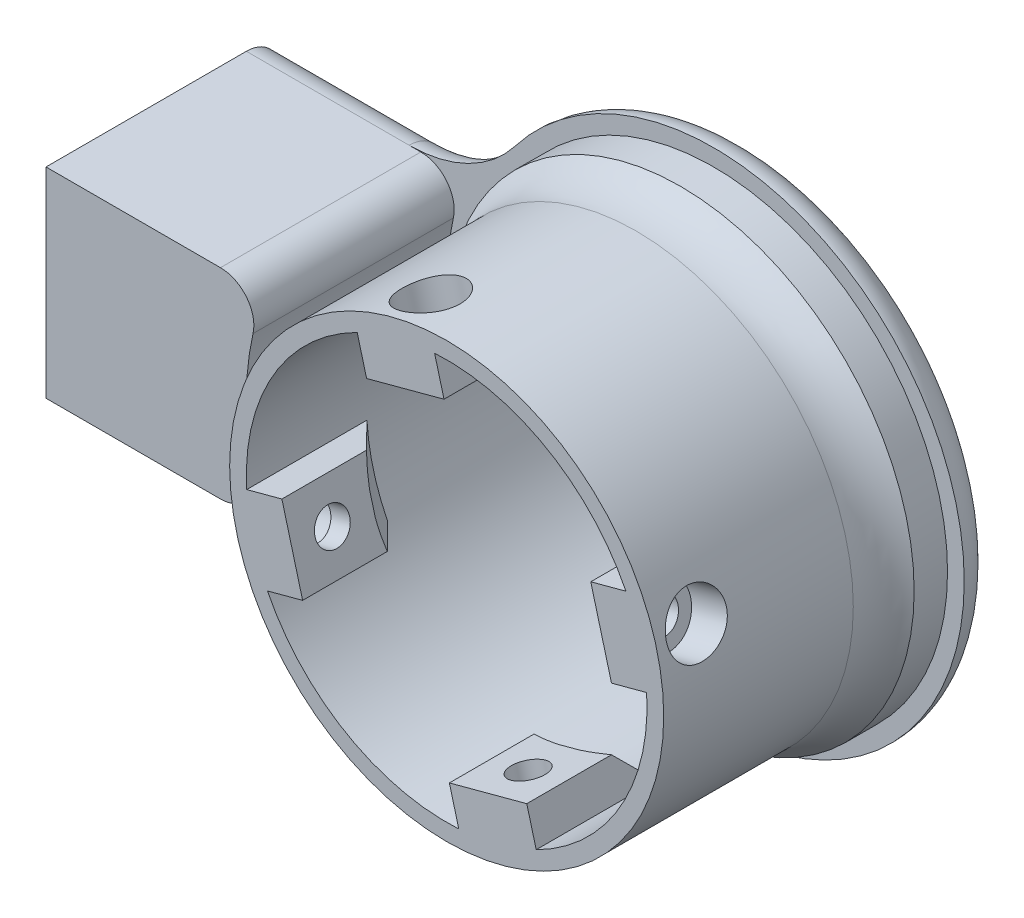
from build123d import *

# Parameters (mm, degrees)
ESQUISSE1_R                               = 30
BOSS_EXTRU_1_DEPTH                        = 5
ESQUISSE6_R                               = 35
ESQUISSE6_R_2                             = 30
BOSS_EXTRU_6_DEPTH                        = 5
ESQUISSE7_R                               = 32.5
ESQUISSE7_R_2                             = 30
BOSS_EXTRU_8_DEPTH                        = 35
CONG_2_R                                  = 10
BOSS_EXTRU_9_DEPTH                        = 30
BOSS_EXTRU_10_DEPTH                       = 12
CHANFREIN1_SIZE                           = 6
CONG_3_R                                  = 5
ENL_V_MAT_EXTRU_1_REACH                   = 89.234
ENL_V_MAT_EXTRU_1_END_RADIUS              = 32.5
ESQUISSE10_R                              = 4.5
ESQUISSE11_R                              = 4.5
ESQUISSE11_R_2                            = 2.6
BOSS_EXTRU_11_DEPTH                       = 3
R_P_TITION_CIRCULAIRE1_COUNT              = 4
CHANFREIN1_OF_R_P_TITION_CIRCULAIRE1_SIZE = 6


# Some blends are built 0.0001 mm under size
with BuildPart() as part:
    # Esquisse1 → Boss.-Extru.1 (new body)
    with BuildSketch(Plane.XY):
        with BuildLine():
            Line((-45.620718977, 15), (-70, 15))
            Line((-70, 15), (-70, -15))
            Line((-70, -15), (-45.620718977, -15))
            ThreePointArc((-45.620718977, -15), (-36.774201608, -17.062911874), (-29.752642811, -22.826086957))
            ThreePointArc((-29.752642811, -22.826086957), (37.5, 0), (-29.752642811, 22.826086957))
            ThreePointArc((-29.752642811, 22.826086957), (-36.774201608, 17.062911874), (-45.620718977, 15))
        make_face()
        Circle(ESQUISSE1_R, mode=Mode.SUBTRACT)
    extrude(amount=BOSS_EXTRU_1_DEPTH)

    # Esquisse6 → Boss.-Extru.6 (add)
    with BuildSketch(Plane.XY.offset(5)):
        Circle(ESQUISSE6_R)
        Circle(ESQUISSE6_R_2, mode=Mode.SUBTRACT)
    extrude(amount=BOSS_EXTRU_6_DEPTH)

    # Esquisse7 → Boss.-Extru.8 (add)
    with BuildSketch(Plane.XY.offset(10)):
        Circle(ESQUISSE7_R)
        Circle(ESQUISSE7_R_2, mode=Mode.SUBTRACT)
    extrude(amount=BOSS_EXTRU_8_DEPTH)

    # Congé2
    # the kernel refuses this fillet: 10 mm, written as the material it adds along each edge
    with BuildSketch(Plane(origin=(0, 0, 10), x_dir=(1, 0, 0), z_dir=(0, -1, 0))) as cong_2_piece_1:
        with BuildLine():
            CenterArc((42.5, 6.614378278), CONG_2_R, 180, 41.409622109)
            Line((32.5, 6.614378278), (32.3, 6.614378278))
            Line((32.3, 6.614378278), (32.3, 0))
            Line((32.3, 0), (32.5, -0.2))
            ThreePointArc((32.5, -0.2), (33.75, -0.2), (34.85, -0.132287566))
            Line((34.85, -0.132287566), (35, 0))
        make_face()
    revolve(axis=Axis((0, 0, 10), (0, 0, 1)))

    # Esquisse8 → Boss.-Extru.9 (add)
    with BuildSketch(Plane.XY.offset(5)):
        with BuildLine():
            Line((-70, -15), (-70, 15))
            Line((-70, 15), (-43.874821937, 15))
            ThreePointArc((-43.874821937, 15), (-39.966142137, 13.118047822), (-38.999841722, 8.888888889))
            ThreePointArc((-38.999841722, 8.888888889), (-40, 0), (-38.999841722, -8.888888889))
            ThreePointArc((-38.999841722, -8.888888889), (-39.966142137, -13.118047822), (-43.874821937, -15))
            Line((-43.874821937, -15), (-70, -15))
        make_face()
    extrude(amount=BOSS_EXTRU_9_DEPTH)

    # Esquisse9 → Boss.-Extru.10 (add)
    with BuildSketch(Plane.XY.offset(45)):
        Polygon((-32.405891584, -2.471475398), (-29.300063043, -14.062585313), (-21.572656433, -11.992032952), (-24.678484974, -0.400923037), align=None)
    boss_extru_10 = extrude(amount=-BOSS_EXTRU_10_DEPTH)

    # Chanfrein1
    # the kernel refuses this chamfer: 6 mm, written as the material it adds along each edge
    with BuildSketch(Plane(origin=(0, 0, 33), x_dir=(-0.5590908430517356, -0.8291064040373223, 0), z_dir=(0.8291064040373223, -0.5590908430517356, 0))) as chanfrein1_piece_1_section:
        Polygon((30, CHANFREIN1_SIZE), (30 - CHANFREIN1_SIZE, 0), (30, 0), align=None)
    chanfrein1_piece_1 = revolve(axis=Axis((0, 0, 33), (0, 0, -1)), revolution_arc=82.01410645, mode=Mode.PRIVATE)
    chanfrein1_piece_1 = split(chanfrein1_piece_1, bisect_by=Plane(origin=(-25.327272202, -12.998079215, 31.008979001), z_dir=(-0.25881904510251486, 0.96592582628907, 0)), keep=Keep.TOP, mode=Mode.PRIVATE)
    chanfrein1_piece_1 = split(chanfrein1_piece_1, bisect_by=Plane(origin=(-28.433100743, -1.4069693, 31.008979001), z_dir=(0.2588190451025147, -0.96592582628907, 0)), keep=Keep.TOP, mode=Mode.PRIVATE)
    chanfrein1_piece_1 = split(chanfrein1_piece_1, bisect_by=Plane(origin=(-23.125570703, -6.196477994, 31.008979001), z_dir=(-0.9659258262890699, -0.2588190451025148, 0)), keep=Keep.TOP, mode=Mode.PRIVATE)
    add(chanfrein1_piece_1)

    # Congé3
    cong_3_edges = [part.edges().sort_by_distance(p)[0] for p in [
        (37.5, 0, 0),
        (-57.810359489, 15, 0),
        (-57.810359489, -15, 0),
        (-36.774201608, -17.062911874, 0),
        (-36.774201608, 17.062911874, 0),
    ]]
    fillet(cong_3_edges, radius=CONG_3_R - 0.0001)  # a hair under: the kernel refuses the full size

    # Enlèv. mat.-Extru.1: up to this cylinder (the profile starts inside it)
    enl_v_mat_extru_1_end = Plane(origin=(0, 0, 39), z_dir=(0, 0, -1)) * Cylinder(ENL_V_MAT_EXTRU_1_END_RADIUS, 244.468, mode=Mode.PRIVATE)
    # Esquisse10 → Enlèv. mat.-Extru.1 (cut, up to the surface)
    with BuildSketch(Plane(origin=(-23.125570703, -6.196477994, 0), x_dir=(0, 0, -1), z_dir=(0.96592582628907, 0.25881904510251497, 0)), mode=Mode.PRIVATE) as enl_v_mat_extru_1_sk1:
        with Locations(Location((-39, 0, 0), (0, 0, 90))):
            Circle(ESQUISSE10_R)
    enl_v_mat_extru_1_tool1 = extrude(enl_v_mat_extru_1_sk1.sketch, amount=-ENL_V_MAT_EXTRU_1_REACH, mode=Mode.PRIVATE) & enl_v_mat_extru_1_end
    enl_v_mat_extru_1 = enl_v_mat_extru_1_tool1.solids().sort_by_distance((-23.125571, -6.196478, 39))[0]
    add(enl_v_mat_extru_1, mode=Mode.SUBTRACT)

    # Esquisse11 → Boss.-Extru.11 (add)
    with BuildSketch(Plane(origin=(-23.125570703, -6.196477994, 0), x_dir=(0, 0, -1), z_dir=(0.96592582628907, 0.25881904510251497, 0))):
        with Locations(Location((-39, 0, 0), (0, 0, 90))):
            Circle(ESQUISSE11_R)
        with Locations(Location((-39, 0, 0), (0, 0, 90))):
            Circle(ESQUISSE11_R_2, mode=Mode.SUBTRACT)
    boss_extru_11 = extrude(amount=-BOSS_EXTRU_11_DEPTH)

    # Répétition circulaire1: Boss.-Extru.10, Enlèv. mat.-Extru.1, Boss.-Extru.11 ×4 about axis
    r_p_tition_circulaire1_axis = Axis((0, 0, 0), (0, 0, 1))
    add([boss_extru_10.rotate(r_p_tition_circulaire1_axis, i * 360 / R_P_TITION_CIRCULAIRE1_COUNT) for i in range(1, R_P_TITION_CIRCULAIRE1_COUNT)])
    add([enl_v_mat_extru_1.rotate(r_p_tition_circulaire1_axis, i * 360 / R_P_TITION_CIRCULAIRE1_COUNT) for i in range(1, R_P_TITION_CIRCULAIRE1_COUNT)], mode=Mode.SUBTRACT)
    add([boss_extru_11.rotate(r_p_tition_circulaire1_axis, i * 360 / R_P_TITION_CIRCULAIRE1_COUNT) for i in range(1, R_P_TITION_CIRCULAIRE1_COUNT)])

    # Chanfrein1 of Répétition circulaire1
    # the kernel refuses this chamfer: 6 mm, written as the material it adds along each edge
    with BuildSketch(Plane(origin=(0, 0, 33), x_dir=(0.8291064040373222, -0.559090843051736, 0), z_dir=(0.559090843051736, 0.8291064040373222, 0))) as chanfrein1_of_r_p_tition_circulaire1_piece_1_section:
        Polygon((30, CHANFREIN1_OF_R_P_TITION_CIRCULAIRE1_SIZE), (30 - CHANFREIN1_OF_R_P_TITION_CIRCULAIRE1_SIZE, 0), (30, 0), align=None)
    chanfrein1_of_r_p_tition_circulaire1_piece_1 = revolve(axis=Axis((0, 0, 33), (0, 0, -1)), revolution_arc=82.01410645, mode=Mode.PRIVATE)
    chanfrein1_of_r_p_tition_circulaire1_piece_1 = split(chanfrein1_of_r_p_tition_circulaire1_piece_1, bisect_by=Plane(origin=(12.998079215, -25.327272202, 31.008979001), z_dir=(-0.96592582628907, -0.25881904510251474, 0)), keep=Keep.TOP, mode=Mode.PRIVATE)
    chanfrein1_of_r_p_tition_circulaire1_piece_1 = split(chanfrein1_of_r_p_tition_circulaire1_piece_1, bisect_by=Plane(origin=(1.4069693, -28.433100743, 31.008979001), z_dir=(0.96592582628907, 0.2588190451025146, 0)), keep=Keep.TOP, mode=Mode.PRIVATE)
    chanfrein1_of_r_p_tition_circulaire1_piece_1 = split(chanfrein1_of_r_p_tition_circulaire1_piece_1, bisect_by=Plane(origin=(6.196477994, -23.125570703, 31.008979001), z_dir=(0.25881904510251474, -0.9659258262890701, 0)), keep=Keep.TOP, mode=Mode.PRIVATE)
    add(chanfrein1_of_r_p_tition_circulaire1_piece_1)
    with BuildSketch(Plane(origin=(0, 0, 33), x_dir=(0.5590908430517355, 0.8291064040373223, 0), z_dir=(-0.8291064040373223, 0.5590908430517355, 0))) as chanfrein1_of_r_p_tition_circulaire1_piece_2_section:
        Polygon((30, CHANFREIN1_OF_R_P_TITION_CIRCULAIRE1_SIZE), (30 - CHANFREIN1_OF_R_P_TITION_CIRCULAIRE1_SIZE, 0), (30, 0), align=None)
    chanfrein1_of_r_p_tition_circulaire1_piece_2 = revolve(axis=Axis((0, 0, 33), (0, 0, -1)), revolution_arc=82.01410645, mode=Mode.PRIVATE)
    chanfrein1_of_r_p_tition_circulaire1_piece_2 = split(chanfrein1_of_r_p_tition_circulaire1_piece_2, bisect_by=Plane(origin=(25.327272202, 12.998079215, 31.008979001), z_dir=(0.25881904510251474, -0.96592582628907, 0)), keep=Keep.TOP, mode=Mode.PRIVATE)
    chanfrein1_of_r_p_tition_circulaire1_piece_2 = split(chanfrein1_of_r_p_tition_circulaire1_piece_2, bisect_by=Plane(origin=(28.433100743, 1.4069693, 31.008979001), z_dir=(-0.2588190451025146, 0.96592582628907, 0)), keep=Keep.TOP, mode=Mode.PRIVATE)
    chanfrein1_of_r_p_tition_circulaire1_piece_2 = split(chanfrein1_of_r_p_tition_circulaire1_piece_2, bisect_by=Plane(origin=(23.125570703, 6.196477994, 31.008979001), z_dir=(0.9659258262890701, 0.25881904510251474, 0)), keep=Keep.TOP, mode=Mode.PRIVATE)
    add(chanfrein1_of_r_p_tition_circulaire1_piece_2)
    with BuildSketch(Plane(origin=(0, 0, 33), x_dir=(-0.8291064040373223, 0.5590908430517356, 0), z_dir=(-0.5590908430517356, -0.8291064040373223, 0))) as chanfrein1_of_r_p_tition_circulaire1_piece_3_section:
        Polygon((30, CHANFREIN1_OF_R_P_TITION_CIRCULAIRE1_SIZE), (30 - CHANFREIN1_OF_R_P_TITION_CIRCULAIRE1_SIZE, 0), (30, 0), align=None)
    chanfrein1_of_r_p_tition_circulaire1_piece_3 = revolve(axis=Axis((0, 0, 33), (0, 0, -1)), revolution_arc=82.01410645, mode=Mode.PRIVATE)
    chanfrein1_of_r_p_tition_circulaire1_piece_3 = split(chanfrein1_of_r_p_tition_circulaire1_piece_3, bisect_by=Plane(origin=(-12.998079215, 25.327272202, 31.008979001), z_dir=(0.9659258262890701, 0.25881904510251463, 0)), keep=Keep.TOP, mode=Mode.PRIVATE)
    chanfrein1_of_r_p_tition_circulaire1_piece_3 = split(chanfrein1_of_r_p_tition_circulaire1_piece_3, bisect_by=Plane(origin=(-1.4069693, 28.433100743, 31.008979001), z_dir=(-0.9659258262890701, -0.25881904510251447, 0)), keep=Keep.TOP, mode=Mode.PRIVATE)
    chanfrein1_of_r_p_tition_circulaire1_piece_3 = split(chanfrein1_of_r_p_tition_circulaire1_piece_3, bisect_by=Plane(origin=(-6.196477994, 23.125570703, 31.008979001), z_dir=(-0.2588190451025146, 0.96592582628907, 0)), keep=Keep.TOP, mode=Mode.PRIVATE)
    add(chanfrein1_of_r_p_tition_circulaire1_piece_3)


solid = part.part
